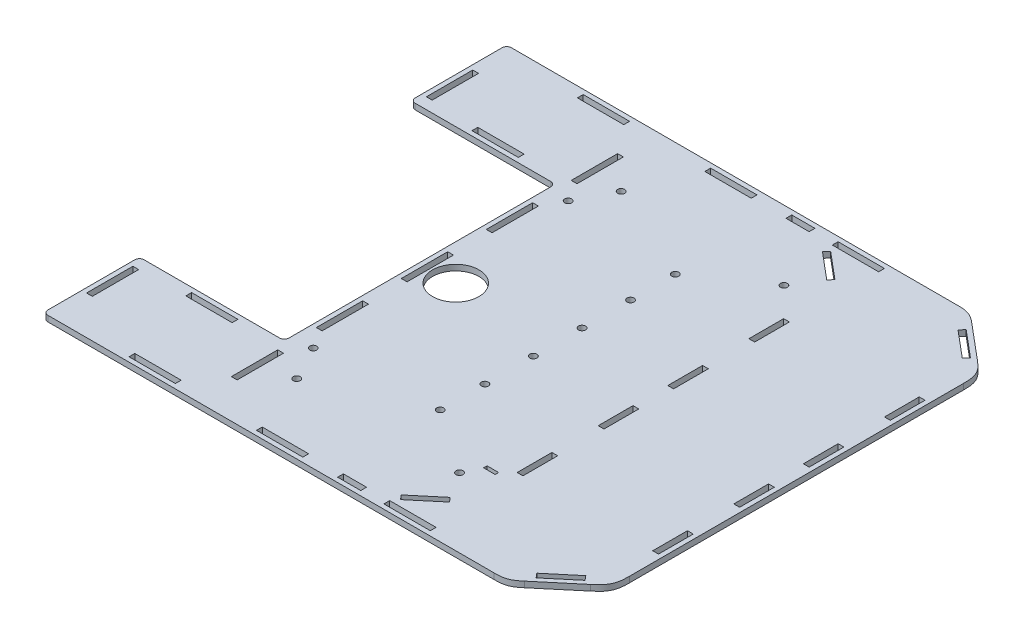
from build123d import *

# Parameters (mm, degrees)
SKETCH1_3_W           = 20
SKETCH1_3_H           = 2.5
SKETCH1_3_W_2         = 2.5
SKETCH1_3_H_2         = 20
SKETCH1_3_R           = 1.5
SKETCH1_3_R_2         = 10
SKETCH1_3_W_3         = 10
SKETCH1_3_W_4         = 5
SKETCH1_3_H_3         = 1.5
SKETCH1_3_H_4         = 15
BOSS_EXTRUDE2_DEPTH   = 2.5
FILLET3_R             = 2
F_3_0MM_DOWEL_HOLE1_D = 3


with BuildPart() as part:
    # Sketch1<3> → Boss-Extrude2 (new body)
    with BuildSketch(Plane(origin=(0, 0, 0), x_dir=(1, 0, 0), z_dir=(0, 1, 0))):
        Polygon((41.5, -100), (100, -100), (125, -79.022509221), (125, 79.022509221), (100, 100), (-100, 100), (-100, 58.5), (-37.5, 58.5), (-37.5, -58.5), (-100, -58.5), (-100, -100), align=None)
        with Locations((-55, -96.75)):
            Rectangle(SKETCH1_3_W, SKETCH1_3_H, mode=Mode.SUBTRACT)
        with Locations((-96.75, -73.333333333)):
            Rectangle(SKETCH1_3_W_2, SKETCH1_3_H_2, mode=Mode.SUBTRACT)
        with Locations((-65.5, -61.75)):
            Rectangle(SKETCH1_3_W, SKETCH1_3_H, mode=Mode.SUBTRACT)
        with Locations((0, -96.75)):
            Rectangle(SKETCH1_3_W, SKETCH1_3_H, mode=Mode.SUBTRACT)
        with Locations((-34.25, -73.333333333)):
            Rectangle(SKETCH1_3_W_2, SKETCH1_3_H_2, mode=Mode.SUBTRACT)
        with Locations(Location((-20.630491407, -70, 0), (0, 0, 270))):
            Circle(SKETCH1_3_R, mode=Mode.SUBTRACT)
        with Locations(Location((-28.5, -55, 0), (0, 0, 270))):
            Circle(SKETCH1_3_R, mode=Mode.SUBTRACT)
        with Locations((-34.25, -36.666666667)):
            Rectangle(SKETCH1_3_W_2, SKETCH1_3_H_2, mode=Mode.SUBTRACT)
        with Locations(Location((-22, 0, 0), (0, 0, 270))):
            Circle(SKETCH1_3_R_2, mode=Mode.SUBTRACT)
        with Locations((30, -96.75)):
            Rectangle(SKETCH1_3_W_3, SKETCH1_3_H, mode=Mode.SUBTRACT)
        Polygon((46.969091457, -92.800072797), (45.362122433, -90.884961689), (56.85278908, -81.243147544), (58.459758104, -83.158258651), align=None, mode=Mode.SUBTRACT)
        Polygon((45, -98), (45, -97.063151291), (45, -95.5), (46.862891167, -95.5), (65, -95.5), (65, -98), align=None, mode=Mode.SUBTRACT)
        with Locations(Location((49.62382474, -70, 0), (0, 0, 270))):
            Circle(SKETCH1_3_R, mode=Mode.SUBTRACT)
        with Locations((55.5, -62.25)):
            Rectangle(SKETCH1_3_W_4, SKETCH1_3_H_3, mode=Mode.SUBTRACT)
        with Locations((63.25, -50.007009332)):
            Rectangle(SKETCH1_3_W_2, SKETCH1_3_H_4, mode=Mode.SUBTRACT)
        Polygon((105.469091457, -92.800072797), (103.862122433, -90.884961689), (115.35278908, -81.243147544), (116.959758104, -83.158258651), align=None, mode=Mode.SUBTRACT)
        with Locations((121.75, -50.007009332)):
            Rectangle(SKETCH1_3_W_2, SKETCH1_3_H_4, mode=Mode.SUBTRACT)
        with Locations((63.25, -15.007009332)):
            Rectangle(SKETCH1_3_W_2, SKETCH1_3_H_4, mode=Mode.SUBTRACT)
        with Locations((121.75, -15.007009332)):
            Rectangle(SKETCH1_3_W_2, SKETCH1_3_H_4, mode=Mode.SUBTRACT)
        with Locations((-34.25, 0)):
            Rectangle(SKETCH1_3_W_2, SKETCH1_3_H_2, mode=Mode.SUBTRACT)
        with Locations((-34.25, 36.666666667)):
            Rectangle(SKETCH1_3_W_2, SKETCH1_3_H_2, mode=Mode.SUBTRACT)
        with Locations((-96.75, 73.333333333)):
            Rectangle(SKETCH1_3_W_2, SKETCH1_3_H_2, mode=Mode.SUBTRACT)
        with Locations((-65.5, 61.75)):
            Rectangle(SKETCH1_3_W, SKETCH1_3_H, mode=Mode.SUBTRACT)
        with Locations((-55, 96.75)):
            Rectangle(SKETCH1_3_W, SKETCH1_3_H, mode=Mode.SUBTRACT)
        with Locations(Location((-28.5, 55, 0), (0, 0, 270))):
            Circle(SKETCH1_3_R, mode=Mode.SUBTRACT)
        with Locations((-34.25, 73.333333333)):
            Rectangle(SKETCH1_3_W_2, SKETCH1_3_H_2, mode=Mode.SUBTRACT)
        with Locations(Location((-20.630491407, 70, 0), (0, 0, 270))):
            Circle(SKETCH1_3_R, mode=Mode.SUBTRACT)
        with Locations((0, 96.75)):
            Rectangle(SKETCH1_3_W, SKETCH1_3_H, mode=Mode.SUBTRACT)
        with Locations((63.25, 15.007009332)):
            Rectangle(SKETCH1_3_W_2, SKETCH1_3_H_4, mode=Mode.SUBTRACT)
        with Locations((121.75, 15.007009332)):
            Rectangle(SKETCH1_3_W_2, SKETCH1_3_H_4, mode=Mode.SUBTRACT)
        with Locations((63.25, 50.007009332)):
            Rectangle(SKETCH1_3_W_2, SKETCH1_3_H_4, mode=Mode.SUBTRACT)
        with Locations(Location((49.62382474, 70, 0), (0, 0, 270))):
            Circle(SKETCH1_3_R, mode=Mode.SUBTRACT)
        with Locations((30, 96.75)):
            Rectangle(SKETCH1_3_W_3, SKETCH1_3_H, mode=Mode.SUBTRACT)
        Polygon((58.459758104, 83.158258651), (56.85278908, 81.243147544), (45.362122433, 90.884961689), (46.969091457, 92.800072797), align=None, mode=Mode.SUBTRACT)
        with Locations((55, 96.75)):
            Rectangle(SKETCH1_3_W, SKETCH1_3_H, mode=Mode.SUBTRACT)
        with Locations((121.75, 50.007009332)):
            Rectangle(SKETCH1_3_W_2, SKETCH1_3_H_4, mode=Mode.SUBTRACT)
        Polygon((116.959758104, 83.158258651), (115.35278908, 81.243147544), (103.862122433, 90.884961689), (105.469091457, 92.800072797), align=None, mode=Mode.SUBTRACT)
    extrude(amount=BOSS_EXTRUDE2_DEPTH)

    # Fillet3
    fillet3_edges = [part.edges().sort_by_distance(p)[0] for p in [
        (-100, 1.25, 100),
        (-100, 1.25, 58.5),
        (-37.5, 1.25, 58.5),
        (-37.5, 1.25, -58.5),
        (-100, 1.25, -58.5),
        (-100, 1.25, -100),
    ]]
    fillet(fillet3_edges, radius=FILLET3_R)

    # Fillet4
    # a fillet whose section is not a circle: 15 mm, written as the material it takes off along each edge
    with BuildSketch(Plane(origin=(125, -17.486537181, -79.022509221), x_dir=(-0.766044443118984, 0, -0.6427876096865321), z_dir=(0, 1, 0))) as fillet4_piece_1:
        with BuildLine():
            add(Edge.make_bspline([(6.994614872, 0), (5.72179927, 0), (4.448983669, 0), (1.608591472, 0.269343455), (-0.82765361, 1.405383194), (-2.859751578, 3.408119217), (-3.677901676, 4.383152536), (-4.496051774, 5.358185855)], knots=[0, 0, 0, 0, 0, 0, 0.5, 0.5, 1, 1, 1, 1, 1, 1], degree=5))
            Line((-4.496051774, 5.358185855), (0, 0))
            Line((0, 0), (6.994614872, 0))
        make_face()
    extrude(amount=37.473074362, mode=Mode.SUBTRACT)
    with BuildSketch(Plane(origin=(100, -13.648883785, -100), x_dir=(-1, 0, 0), z_dir=(0, 1, 0))) as fillet4_piece_2:
        with BuildLine():
            add(Edge.make_bspline([(5.459553514, 0), (4.454983441, 0), (3.450413367, 0), (1.210308026, 0.165316368), (-0.820886425, 0.904610688), (-2.643169986, 2.217882961), (-3.412715309, 2.863608157), (-4.182260631, 3.509333353)], knots=[0, 0, 0, 0, 0, 0, 0.5, 0.5, 1, 1, 1, 1, 1, 1], degree=5))
            Line((-4.182260631, 3.509333353), (0, 0))
            Line((0, 0), (5.459553514, 0))
        make_face()
    extrude(amount=29.79776757, mode=Mode.SUBTRACT)
    with BuildSketch(Plane(origin=(125, -17.486537181, 79.022509221), x_dir=(-0.7660444431189616, 0, 0.642787609686559), z_dir=(0, 1, 0))) as fillet4_piece_3:
        with BuildLine():
            add(Edge.make_bspline([(6.994614872, 0), (5.72179927, 0), (4.448983669, 0), (1.608591472, -0.269343455), (-0.82765361, -1.405383194), (-2.859751578, -3.408119217), (-3.677901676, -4.383152536), (-4.496051774, -5.358185855)], knots=[0, 0, 0, 0, 0, 0, 0.5, 0.5, 1, 1, 1, 1, 1, 1], degree=5))
            Line((-4.496051774, -5.358185855), (0, 0))
            Line((0, 0), (6.994614872, 0))
        make_face()
    extrude(amount=37.473074362, mode=Mode.SUBTRACT)
    with BuildSketch(Plane(origin=(100, -13.648883785, 100), x_dir=(-1, 0, 0), z_dir=(0, 1, 0))) as fillet4_piece_4:
        with BuildLine():
            add(Edge.make_bspline([(5.459553514, 0), (4.454983441, 0), (3.450413367, 0), (1.210308026, -0.165316368), (-0.820886425, -0.904610688), (-2.643169986, -2.217882961), (-3.412715309, -2.863608157), (-4.182260631, -3.509333353)], knots=[0, 0, 0, 0, 0, 0, 0.5, 0.5, 1, 1, 1, 1, 1, 1], degree=5))
            Line((-4.182260631, -3.509333353), (0, 0))
            Line((0, 0), (5.459553514, 0))
        make_face()
    extrude(amount=29.79776757, mode=Mode.SUBTRACT)

    # Ø3.0mm Dowel Hole1 (through all)
    with Locations(Plane(origin=(0, 2.5, 0), x_dir=(1, 0, 0), z_dir=(0, 1, 0))):
        with Locations((22, 50.71), (22, 31.41), (22, 10.5), (22, -10.5), (22, -31.41), (22, -50.71)):
            Hole(F_3_0MM_DOWEL_HOLE1_D / 2)


solid = part.part
